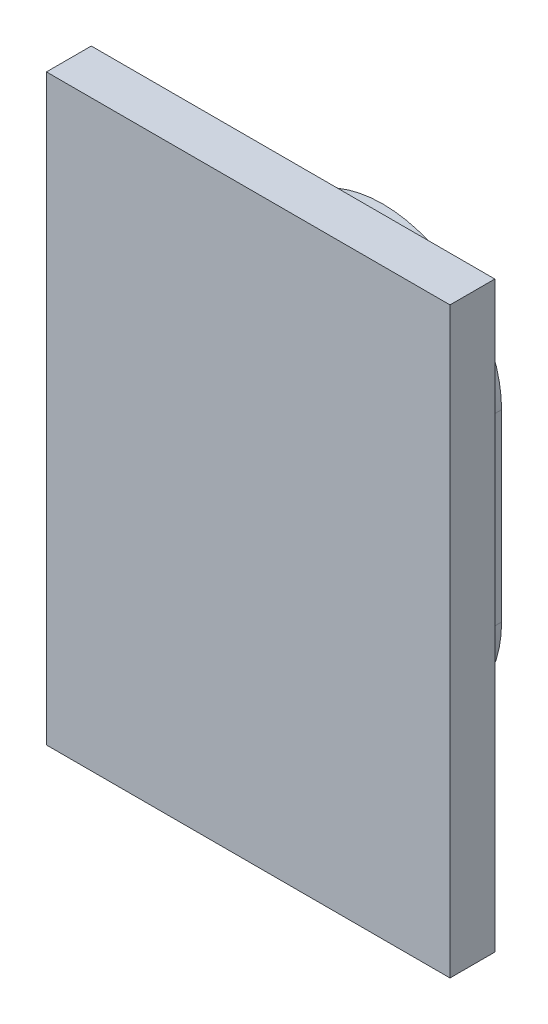
from build123d import *

# Parameters (mm, degrees)
SKETCH1_W           = 45
SKETCH1_H           = 65
BOSS_EXTRUDE1_DEPTH = 5
BOSS_EXTRUDE2_DEPTH = 10


with BuildPart() as part:
    # Sketch1 → Boss-Extrude1 (new body)
    with BuildSketch(Plane.XY):
        with Locations((2.886207951, -16.286739239)):
            Rectangle(SKETCH1_W, SKETCH1_H)
    extrude(amount=BOSS_EXTRUDE1_DEPTH)

    # Sketch4 → Boss-Extrude2 (add)
    with BuildSketch(Plane(origin=(0, 0, 0), x_dir=(-1, 0, 0), z_dir=(0, 0, -1))):
        with BuildLine():
            Line((10.363792049, -6.036739239), (10.363792049, -26.536739239))
            ThreePointArc((10.363792049, -26.536739239), (-2.886207951, -39.786739239), (-16.136207951, -26.536739239))
            Line((-16.136207951, -26.536739239), (-16.136207951, -6.036739239))
            ThreePointArc((-16.136207951, -6.036739239), (-2.886207951, 7.213260761), (10.363792049, -6.036739239))
        make_face()
        with BuildLine():
            Line((7.863792049, -6.036739239), (7.863792049, -26.536739239))
            ThreePointArc((7.863792049, -26.536739239), (-2.886207951, -37.286739239), (-13.636207951, -26.536739239))
            Line((-13.636207951, -26.536739239), (-13.636207951, -6.036739239))
            ThreePointArc((-13.636207951, -6.036739239), (-2.886207951, 4.713260761), (7.863792049, -6.036739239))
        make_face(mode=Mode.SUBTRACT)
    extrude(amount=BOSS_EXTRUDE2_DEPTH)


solid = part.part
